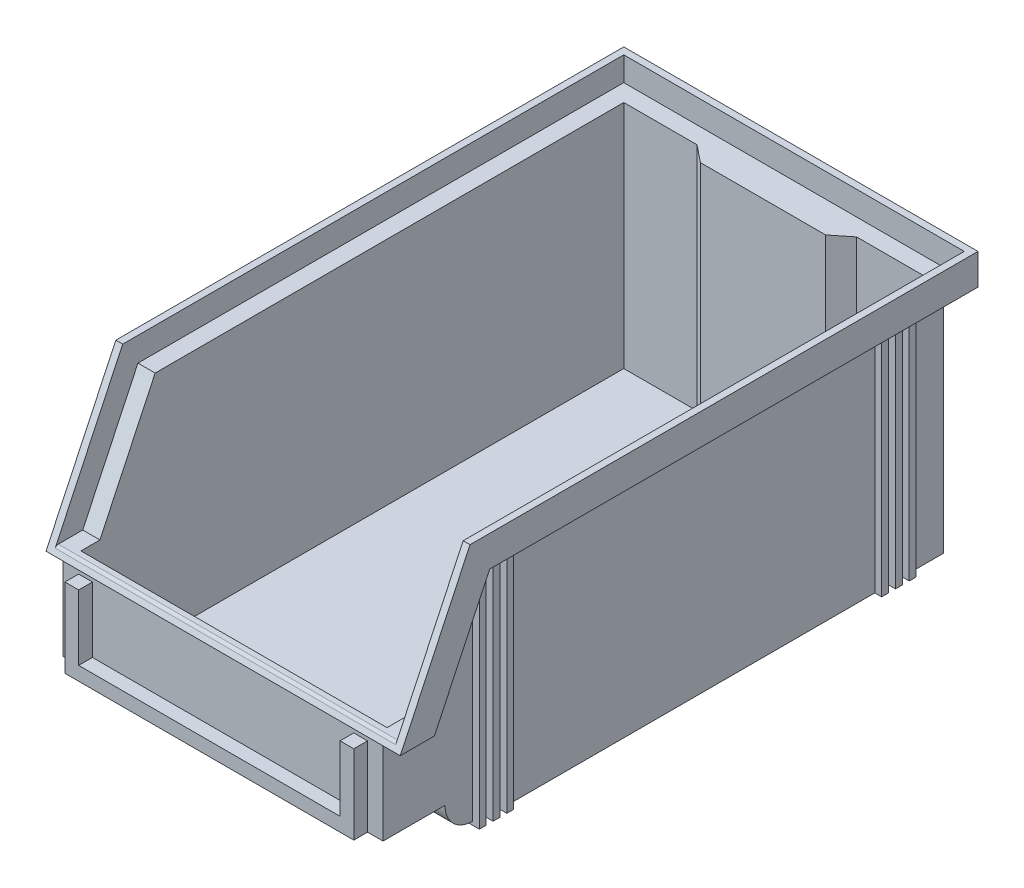
from build123d import *

# Parameters (mm, degrees)
BOSS_EXTRUDE1_DEPTH = 67
SKETCH2_W           = 103
SKETCH2_H           = 142
BOSS_EXTRUDE2_DEPTH = 9
SKETCH3_W           = 90
SKETCH3_H           = 2
BOSS_EXTRUDE3_DEPTH = 4
SKETCH4_W           = 93
SKETCH4_H           = 24
BOSS_EXTRUDE4_DEPTH = 26
BOSS_EXTRUDE5_DEPTH = 93
BOSS_EXTRUDE6_REACH = 161.108
BOSS_EXTRUDE7_DEPTH = 93
SHELL5_START        = -44.5
SHELL5_DEPTH        = 89
SHELL5_START_2      = -49.5
SHELL5_2_DEPTH      = 99
SHELL5_3_OUTLINE_W  = 67
SHELL5_3_OUTLINE_H  = 4
SHELL5_3_DEPTH      = 21.298437881
SHELL5_START_3      = 23.201562119
SHELL5_4_OUTLINE_W  = 67
SHELL5_4_OUTLINE_H  = 4
SHELL5_4_DEPTH      = 21.298437881
SHELL5_START_4      = 2
SHELL5_5_DEPTH      = 67
CUT_EXTRUDE1_REACH  = 193.448
SKETCH11_W          = 99
SKETCH11_H          = 41
FILLET2_R           = 1
SKETCH12_W          = 2
SKETCH12_H          = 67
BOSS_EXTRUDE8_DEPTH = 2
SKETCH13_W          = 76
SKETCH13_H          = 4
BOSS_EXTRUDE9_DEPTH = 4


with BuildPart() as part:
    # Sketch1 → Boss-Extrude1 (new body)
    with BuildSketch(Plane(origin=(0, 0, 0), x_dir=(1, 0, 0), z_dir=(0, 1, 0))):
        Polygon((-17.5, 64.5), (17.5, 64.5), (22.5, 68.5), (46.5, 68.5), (46.5, -68.5), (-46.5, -68.5), (-46.5, 68.5), (-22.5, 68.5), align=None)
    extrude(amount=BOSS_EXTRUDE1_DEPTH)

    # Sketch2 → Boss-Extrude2 (add)
    with BuildSketch(Plane(origin=(0, 67, 0), x_dir=(1, 0, 0), z_dir=(0, 1, 0))):
        with Locations((0, 2.5)):
            Rectangle(SKETCH2_W, SKETCH2_H)
    extrude(amount=BOSS_EXTRUDE2_DEPTH)

    # Sketch3 → Boss-Extrude3 (add)
    with BuildSketch(Plane.XZ.offset(-67)):
        with Locations((0, -72.5)):
            Rectangle(SKETCH3_W, SKETCH3_H)
    extrude(amount=BOSS_EXTRUDE3_DEPTH)

    # Sketch4 → Boss-Extrude4 (add)
    with BuildSketch(Plane.XY.offset(68.5)):
        with Locations((0, 21)):
            Rectangle(SKETCH4_W, SKETCH4_H)
    extrude(amount=BOSS_EXTRUDE4_DEPTH)

    # Sketch5 → Boss-Extrude5 (add)
    with BuildSketch(Plane.ZY.offset(46.5)):
        Polygon((68.5, 67), (94.5, 33), (68.5, 33), align=None)
    extrude(amount=-BOSS_EXTRUDE5_DEPTH)

    # Boss-Extrude6: up to this face of the body (flat: up to its plane)
    boss_extrude6_end = Plane(part.part.faces().sort_by_distance((51.5, 71.5, -2.5))[0])
    # Sketch7 → Boss-Extrude6 (add, up to the picked face)
    with BuildSketch(Plane.ZY.offset(51.5), mode=Mode.PRIVATE) as boss_extrude6_sk1:
        Polygon((68.5, 67), (84.547855551, 33), (94.5, 33), (74.204182686, 76), (68.5, 76), align=None)
    boss_extrude6_tool1 = split(extrude(boss_extrude6_sk1.sketch, amount=-BOSS_EXTRUDE6_REACH, mode=Mode.PRIVATE), bisect_by=boss_extrude6_end, keep=Keep.BOTH, mode=Mode.PRIVATE)
    add(boss_extrude6_tool1.solids().sort_by(Axis((-51.5, 53.63498, 79.950766), (1, 0, 0)))[0])

    # Sketch8 → Boss-Extrude7 (add)
    with BuildSketch(Plane.ZY.offset(46.5)):
        with BuildLine():
            Line((76.5, 9), (68.5, 9))
            Line((68.5, 9), (68.5, 1))
            ThreePointArc((68.5, 1), (74.156854249, 3.343145751), (76.5, 9))
        make_face()
    extrude(amount=-BOSS_EXTRUDE7_DEPTH)

    # Shell5: read off the stored shape, not the designer's step
    # Shell5 outline → Shell5 (cut)
    with BuildSketch(Plane.YZ.offset(SHELL5_START)):
        with BuildLine():
            Line((69, -71.5), (76, -71.5))
            Line((76, -71.5), (76, 71.992595031))
            Line((76, 71.992595031), (32.551717034, 92.5))
            Line((32.551717034, 92.5), (11, 92.5))
            Line((11, 92.5), (11, 74.156854249))
            ThreePointArc((11, 74.156854249), (4.757359313, 72.742640687), (3.343145751, 66.5))
            Line((3.343145751, 66.5), (2, 66.5))
            Line((2, 66.5), (2, -62.5))
            Line((2, -62.5), (69, -62.5))
            Line((69, -62.5), (69, -71.5))
        make_face()
    extrude(amount=SHELL5_DEPTH, mode=Mode.SUBTRACT)

    # Shell5 2 outline → Shell5 2 (cut)
    with BuildSketch(Plane.YZ.offset(SHELL5_START_2)):
        Polygon((69, -71.5), (76, -71.5), (76, 71.992595031), (35, 91.344420842), (35, 85.815451703), (69, 69.767596152), align=None)
    extrude(amount=SHELL5_2_DEPTH, mode=Mode.SUBTRACT)

    # Shell5 3 outline → Shell5 3 (cut)
    with BuildSketch(Plane.YZ.offset(SHELL5_START)):
        with Locations((35.5, -64.5)):
            Rectangle(SHELL5_3_OUTLINE_W, SHELL5_3_OUTLINE_H)
    extrude(amount=SHELL5_3_DEPTH, mode=Mode.SUBTRACT)

    # Shell5 4 outline → Shell5 4 (cut)
    with BuildSketch(Plane.YZ.offset(SHELL5_START_3)):
        with Locations((35.5, -64.5)):
            Rectangle(SHELL5_4_OUTLINE_W, SHELL5_4_OUTLINE_H)
    extrude(amount=SHELL5_4_DEPTH, mode=Mode.SUBTRACT)

    # Shell5 5 outline → Shell5 5 (cut)
    with BuildSketch(Plane(origin=(0, 0, 0), x_dir=(1, 0, 0), z_dir=(0, 1, 0)).offset(SHELL5_START_4)):
        Polygon((-23.201562119, 62.5), (-18.201562119, 62.5), (-23.201562119, 66.5), align=None)
        Polygon((23.201562119, 66.5), (18.201562119, 62.5), (23.201562119, 62.5), align=None)
    extrude(amount=SHELL5_5_DEPTH, mode=Mode.SUBTRACT)

    # Cut-Extrude1: up to this face of the body (flat: up to its plane)
    cut_extrude1_end = Plane(part.part.faces().sort_by_distance((-47, 52, 77.791523927))[0])
    # Sketch11 → Cut-Extrude1 (cut, up to the picked face)
    with BuildSketch(Plane.XY.offset(94.5), mode=Mode.PRIVATE) as cut_extrude1_sk1:
        with Locations((0, 55.5)):
            Rectangle(SKETCH11_W, SKETCH11_H)
    cut_extrude1_tool1 = split(extrude(cut_extrude1_sk1.sketch, amount=-CUT_EXTRUDE1_REACH, mode=Mode.PRIVATE), bisect_by=cut_extrude1_end, keep=Keep.BOTH, mode=Mode.PRIVATE)
    add(cut_extrude1_tool1.solids().sort_by(Axis((0, 55.5, 94.5), (0, 0, -1)))[0], mode=Mode.SUBTRACT)

    # Fillet2
    fillet2_edges = [part.edges().sort_by_distance(p)[0] for p in [
        (0, 35, 93.556008497),
    ]]
    fillet(fillet2_edges, radius=FILLET2_R)

    # Sketch12 → Boss-Extrude8 (add)
    with BuildSketch(Plane.ZY.offset(46.5)):
        with Locations((-57.5, 33.5)):
            Rectangle(SKETCH12_W, SKETCH12_H)
        with Locations((-53.5, 33.5)):
            Rectangle(SKETCH12_W, SKETCH12_H)
        with Locations((-49.5, 33.5)):
            Rectangle(SKETCH12_W, SKETCH12_H)
        with Locations((59.5, 33.5)):
            Rectangle(SKETCH12_W, SKETCH12_H)
        with Locations((63.5, 33.5)):
            Rectangle(SKETCH12_W, SKETCH12_H)
        with Locations((67.5, 33.5)):
            Rectangle(SKETCH12_W, SKETCH12_H)
    boss_extrude8 = extrude(amount=BOSS_EXTRUDE8_DEPTH)

    # Mirror1: Boss-Extrude8 across plane
    add(boss_extrude8.mirror(Plane(origin=(0, 0, 0), x_dir=(0, 0, 1), z_dir=(1, 0, 0))))

    # Sketch13 → Boss-Extrude9 (add)
    with BuildSketch(Plane.XY.offset(94.5)):
        Polygon((-42, 32), (-42, 9), (-38, 9), (-38, 13), (-38, 32), align=None)
        with Locations((0, 11)):
            Rectangle(SKETCH13_W, SKETCH13_H)
        Polygon((38, 13), (38, 9), (42, 9), (42, 32), (38, 32), align=None)
    extrude(amount=BOSS_EXTRUDE9_DEPTH)


solid = part.part
